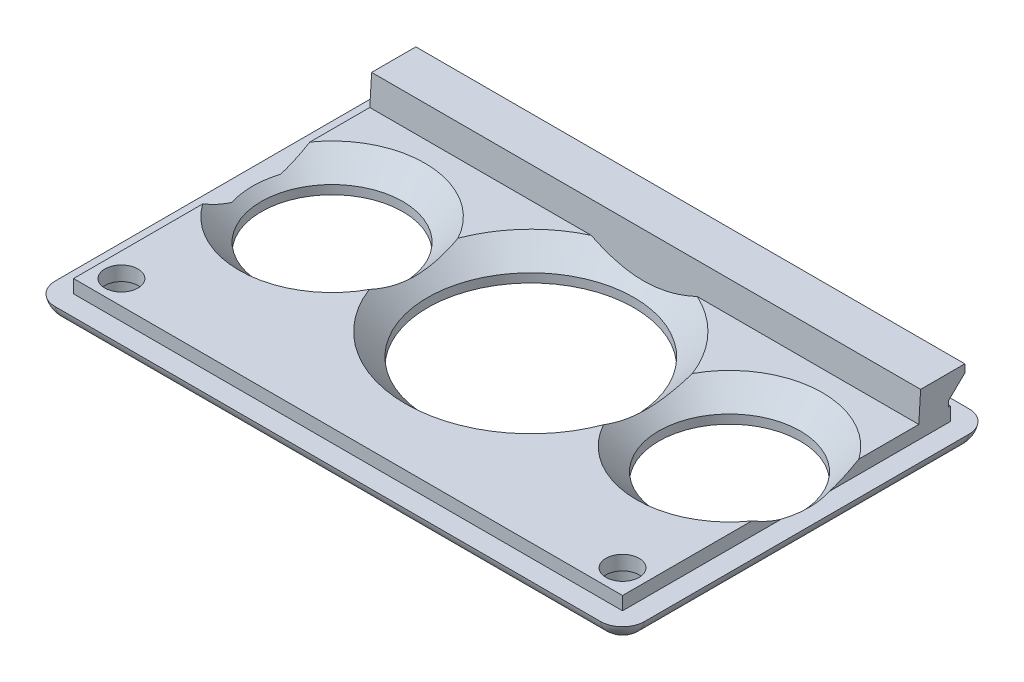
from build123d import *

# Parameters (mm, degrees)
SKETCH1_W           = 80
SKETCH1_H           = 50
BOSS_EXTRUDE1_DEPTH = 2.4
SKETCH2_W           = 74.5
SKETCH2_H           = 44.5
BOSS_EXTRUDE2_DEPTH = 1.8
SKETCH4_R           = 9.6
SKETCH4_R_2         = 14
SKETCH4_R_3         = 2.25
CUT_EXTRUDE1_DEPTH  = 95.013072971
BOSS_EXTRUDE3_DEPTH = 74.5
FILLET1_R           = 3
FILLET2_R           = 3
SKETCH7_R           = 3
CUT_EXTRUDE3_DEPTH  = 2.25
CHAMFER1_SIZE       = 3


with BuildPart() as part:
    # Sketch1 → Boss-Extrude1 (new body)
    with BuildSketch(Plane(origin=(0, 0, 0), x_dir=(1, 0, 0), z_dir=(0, 1, 0))):
        with Locations((38.753665689, 26.173020528)):
            Rectangle(SKETCH1_W, SKETCH1_H)
    extrude(amount=BOSS_EXTRUDE1_DEPTH)

    # Sketch2 → Boss-Extrude2 (add)
    with BuildSketch(Plane(origin=(0, 2.4, 0), x_dir=(1, 0, 0), z_dir=(0, 1, 0))):
        with Locations((38.753665689, 26.173020528)):
            Rectangle(SKETCH2_W, SKETCH2_H)
    extrude(amount=BOSS_EXTRUDE2_DEPTH)

    # Sketch4 → Cut-Extrude1 (cut, through all)
    with BuildSketch(Plane(origin=(0, 0, 0), x_dir=(-1, 0, 0), z_dir=(0, -1, 0))):
        with Locations(Location((-65.718665689, 28.723020528, 0), (0, 0, 90))):
            Circle(SKETCH4_R)
        with Locations(Location((-38.753665689, 28.723020528, 0), (0, 0, 90))):
            Circle(SKETCH4_R_2)
        with Locations(Location((-11.788665689, 28.723020528, 0), (0, 0, 90))):
            Circle(SKETCH4_R)
        with Locations(Location((-72.753665689, 7.173020528, 0), (0, 0, 90))):
            Circle(SKETCH4_R_3)
        with Locations(Location((-4.753665689, 7.173020528, 0), (0, 0, 90))):
            Circle(SKETCH4_R_3)
    extrude(amount=-CUT_EXTRUDE1_DEPTH, mode=Mode.SUBTRACT)

    # Sketch5 → Boss-Extrude3 (add)
    with BuildSketch(Plane(origin=(76.003665689, 0, 0), x_dir=(0, 0, -1), z_dir=(1, 0, 0))):
        Polygon((48.123020528, 4.2), (44.123020528, 4.2), (44.373020528, 8.2), (50.373020528, 8.2), (50.373020528, 7.1), (48.142477117, 4.978263585), align=None)
    extrude(amount=-BOSS_EXTRUDE3_DEPTH)

    # Fillet1
    fillet1_edges = [part.edges().sort_by_distance(p)[0] for p in [
        (-1.246334311, 1.2, -51.173020528),
        (78.753665689, 1.2, -51.173020528),
        (78.753665689, 1.2, -1.173020528),
        (-1.246334311, 1.2, -1.173020528),
    ]]
    fillet(fillet1_edges, radius=FILLET1_R)

    # Fillet2
    # the kernel refuses this fillet: 3 mm, written as the material it takes off along each edge
    with BuildSketch(Plane(origin=(1.753665689, 0, -48.173020528), x_dir=(-1, 0, 0), z_dir=(0, 0, 1))) as fillet2_piece_1:
        with BuildLine():
            CenterArc((0.060612309, -3), FILLET2_R, 11.536959033, 78.463040967)
            Line((3, -2.4), (3.058787754, -2.388))
            ThreePointArc((3.058787754, -2.388), (3.06, -1.2), (3.06, 0))
            Line((3.06, 0), (3, 0.06))
            Line((3, 0.06), (0.060612309, 0.06))
            Line((0.060612309, 0.06), (0.060612309, 0))
        make_face()
    revolve(axis=Axis((1.753665689, 0, -48.173020528), (0, -1, 0)), revolution_arc=90, mode=Mode.SUBTRACT)
    with BuildSketch(Plane(origin=(75.753665689, 0, -51.173020528), x_dir=(0, 0, 1), z_dir=(-1, 0, 0))) as fillet2_piece_2:
        with BuildLine():
            CenterArc((2.939387691, 3), FILLET2_R, 191.536959033, 78.463040967)
            Line((0, 2.4), (-0.058787754, 2.388))
            ThreePointArc((-0.058787754, 2.388), (-0.06, 1.2), (-0.06, 0))
            Line((-0.06, 0), (0, -0.06))
            Line((0, -0.06), (2.939387691, -0.06))
            Line((2.939387691, -0.06), (2.939387691, 0))
        make_face()
    extrude(amount=74, mode=Mode.SUBTRACT)
    with BuildSketch(Plane(origin=(75.753665689, 0, -48.173020528), x_dir=(1, 0, 0), z_dir=(0, 0, 1))) as fillet2_piece_3:
        with BuildLine():
            CenterArc((0.060612309, 3), FILLET2_R, 270, 78.463040967)
            Line((3, 2.4), (3.058787754, 2.388))
            ThreePointArc((3.058787754, 2.388), (3.06, 1.2), (3.06, 0))
            Line((3.06, 0), (3, -0.06))
            Line((3, -0.06), (0.060612309, -0.06))
            Line((0.060612309, -0.06), (0.060612309, 0))
        make_face()
    revolve(axis=Axis((75.753665689, 0, -48.173020528), (0, 1, 0)), revolution_arc=90, mode=Mode.SUBTRACT)
    with BuildSketch(Plane(origin=(78.753665689, 0, -4.173020528), x_dir=(-1, 0, 0), z_dir=(0, 0, -1)), Plane(origin=(-1.246334311, 0, -48.173020528), x_dir=(1, 0, 0), z_dir=(0, 0, 1))) as fillet2_piece_4:
        with BuildLine():
            CenterArc((2.939387691, 3), FILLET2_R, 191.536959033, 78.463040967)
            Line((0, 2.4), (-0.058787754, 2.388))
            ThreePointArc((-0.058787754, 2.388), (-0.06, 1.2), (-0.06, 0))
            Line((-0.06, 0), (0, -0.06))
            Line((0, -0.06), (2.939387691, -0.06))
            Line((2.939387691, -0.06), (2.939387691, 0))
        make_face()
    extrude(amount=44, mode=Mode.SUBTRACT)
    with BuildSketch(Plane(origin=(75.753665689, 0, -4.173020528), x_dir=(0, 0, 1), z_dir=(-1, 0, 0))) as fillet2_piece_5:
        with BuildLine():
            CenterArc((0.060612309, 3), FILLET2_R, 270, 78.463040967)
            Line((3, 2.4), (3.058787754, 2.388))
            ThreePointArc((3.058787754, 2.388), (3.06, 1.2), (3.06, 0))
            Line((3.06, 0), (3, -0.06))
            Line((3, -0.06), (0.060612309, -0.06))
            Line((0.060612309, -0.06), (0.060612309, 0))
        make_face()
    revolve(axis=Axis((75.753665689, 0, -4.173020528), (0, 1, 0)), revolution_arc=90, mode=Mode.SUBTRACT)
    with BuildSketch(Plane(origin=(1.753665689, 0, -1.173020528), x_dir=(0, 1.0, -1.5658770576478976e-12), z_dir=(1, 0, 0))) as fillet2_piece_6:
        with BuildLine():
            CenterArc((3, -2.939387691), FILLET2_R, 101.536959033, 78.463040967)
            Line((0, -2.939387691), (-0.06, -2.939387691))
            Line((-0.06, -2.939387691), (-0.06, 0))
            Line((-0.06, 0), (0, 0.06))
            ThreePointArc((0, 0.06), (1.2, 0.06), (2.388, 0.058787754))
            Line((2.388, 0.058787754), (2.4, 0))
        make_face()
    extrude(amount=74, mode=Mode.SUBTRACT)
    with BuildSketch(Plane(origin=(1.753665689, 0, -4.173020528), x_dir=(0, 0, 1), z_dir=(1, 0, 0))) as fillet2_piece_7:
        with BuildLine():
            CenterArc((0.060612309, -3), FILLET2_R, 11.536959033, 78.463040967)
            Line((3, -2.4), (3.058787754, -2.388))
            ThreePointArc((3.058787754, -2.388), (3.06, -1.2), (3.06, 0))
            Line((3.06, 0), (3, 0.06))
            Line((3, 0.06), (0.060612309, 0.06))
            Line((0.060612309, 0.06), (0.060612309, 0))
        make_face()
    revolve(axis=Axis((1.753665689, 0, -4.173020528), (0, -1, 0)), revolution_arc=90, mode=Mode.SUBTRACT)

    # Sketch7 → Cut-Extrude3 (cut)
    with BuildSketch(Plane.XZ):
        with Locations(Location((4.753665689, -7.173020528, 0), (0, 0, 270))):
            Circle(SKETCH7_R)
        with Locations(Location((72.753665689, -7.173020528, 0), (0, 0, 270))):
            Circle(SKETCH7_R)
    extrude(amount=-CUT_EXTRUDE3_DEPTH, mode=Mode.SUBTRACT)

    # Chamfer1
    # the kernel refuses this chamfer: 3 mm, written as the material it takes off along each edge
    with BuildSketch(Plane(origin=(11.788665689, 4.2, -28.723020528), x_dir=(0, 0, -1), z_dir=(-1, 0, 0))) as chamfer1_piece_1:
        Polygon((9.6 + CHAMFER1_SIZE, 0), (9.6, CHAMFER1_SIZE), (9.6, 0), align=None)
    revolve(axis=Axis((11.788665689, 4.2, -28.723020528), (0, -1, 0)), mode=Mode.SUBTRACT)
    with BuildSketch(Plane(origin=(38.753665689, 4.2, -28.723020528), x_dir=(0, 0, -1), z_dir=(-1, 0, 0))) as chamfer1_piece_2_section:
        Polygon((14 + CHAMFER1_SIZE, 0), (14, CHAMFER1_SIZE), (14, 0), align=None)
    chamfer1_piece_2 = revolve(axis=Axis((38.753665689, 4.2, -28.723020528), (0, -1, 0)), mode=Mode.PRIVATE)
    chamfer1_piece_2 = split(chamfer1_piece_2, bisect_by=Plane(origin=(38.753665689, 0.839630842, -43.912997455), z_dir=(0, 0.06237828615517877, 0.9980525784828888)), keep=Keep.TOP, mode=Mode.PRIVATE)
    add(chamfer1_piece_2, mode=Mode.SUBTRACT)
    with BuildSketch(Plane(origin=(65.718665689, 4.2, -28.723020528), x_dir=(0, 0, -1), z_dir=(-1, 0, 0))) as chamfer1_piece_3:
        Polygon((9.6 + CHAMFER1_SIZE, 0), (9.6, CHAMFER1_SIZE), (9.6, 0), align=None)
    revolve(axis=Axis((65.718665689, 4.2, -28.723020528), (0, -1, 0)), mode=Mode.SUBTRACT)


solid = part.part
